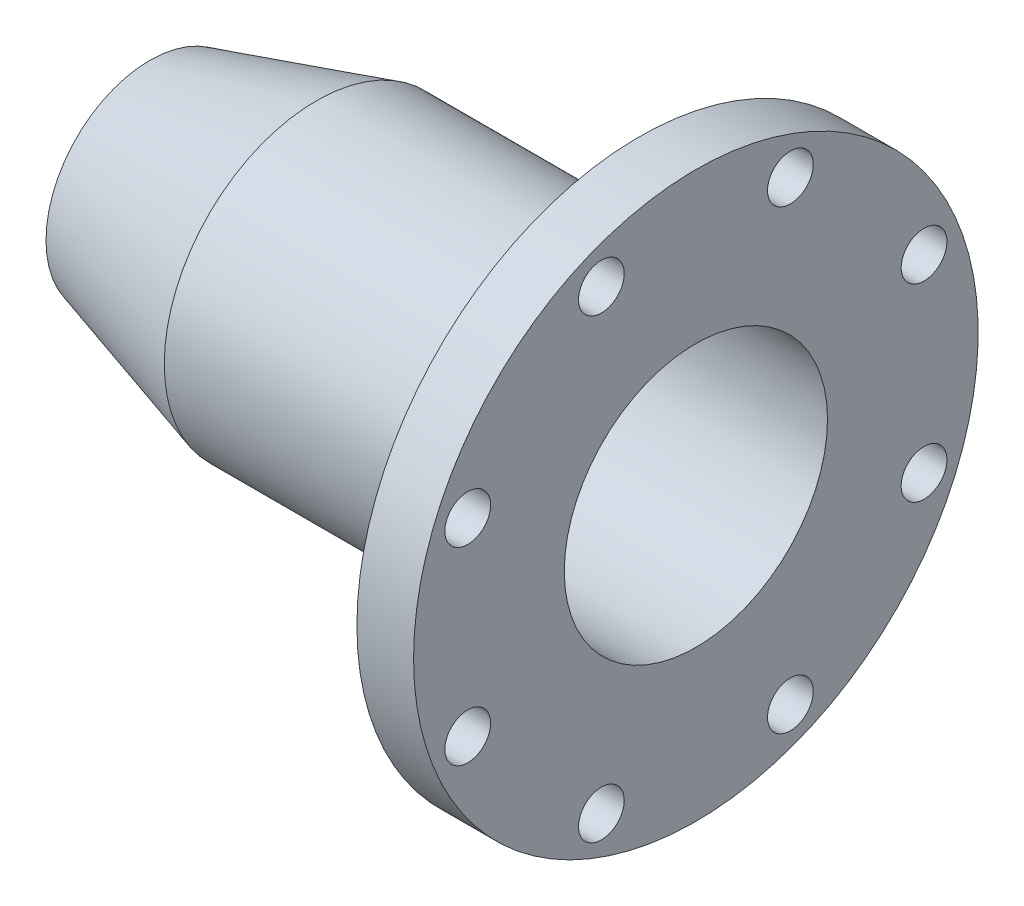
from build123d import *

# Parameters (mm, degrees)
F_1_16_0_88_DIAMETER_HOLE1_D = 22.352
CIRPATTERN1_COUNT            = 8


with BuildPart() as part:
    # Sketch1 → Revolve1 (revolve)
    with BuildSketch(Plane.XY):
        Polygon((266.7, 64.295), (266.7, 137.92), (239.01, 137.92), (239.01, 74.295), (81.28, 74.295), (0, 50.8), (0, 40.390594979), (82.696320073, 64.295), (239.01, 64.295), align=None)
    revolve(axis=Axis((0, 0, 0), (1, 0, 0)))

    # 1/16 (0.88) Diameter Hole1 (through all)
    with Locations(Plane(origin=(266.7, 111.466065597, 46.170756115), x_dir=(0, 0, 1), z_dir=(1, 0, 0))):
        with Locations((0, 0)):
            f_1_16_0_88_diameter_hole1 = Hole(F_1_16_0_88_DIAMETER_HOLE1_D / 2)

    # CirPattern1: 1/16 (0.88) Diameter Hole1 ×8 about axis
    cirpattern1_axis = Axis((0, 0, 0), (-1, 0, 0))
    for i in range(1, CIRPATTERN1_COUNT):
        add(f_1_16_0_88_diameter_hole1.rotate(cirpattern1_axis, i * 360 / CIRPATTERN1_COUNT), mode=Mode.SUBTRACT)


solid = part.part
